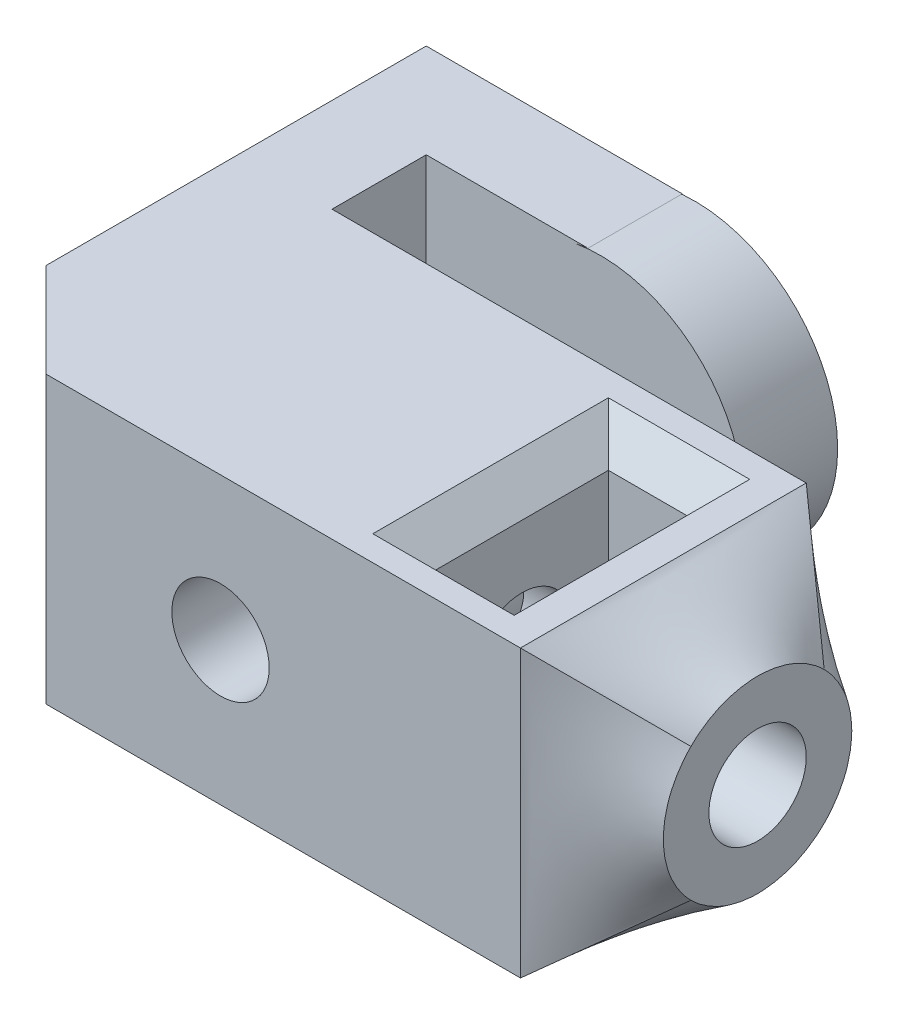
from build123d import *

# Parameters (mm, degrees)
SKETCH1_R               = 4.55
SKETCH1_R_2             = 1.55
BOSS_EXTRUDE1_DEPTH     = 9.1
SKETCH2_R               = 1.55
BOSS_EXTRUDE2_DEPTH     = 3
SKETCH3_W               = 15.1
SKETCH3_H               = 9.1
BOSS_EXTRUDE3_DEPTH     = 3
CUT_EXTRUDE1_REACH      = 26.036
CUT_EXTRUDE1_END_RADIUS = 3.55
SKETCH4_R               = 1.55
SKETCH5_R               = 1.55
CUT_EXTRUDE2_DEPTH      = 2.5
CHAMFER1_SIZE           = 1
CHAMFER2_SIZE           = 3


with BuildPart() as part:
    # Sketch1 → Boss-Extrude1 (new body)
    # profile 1 of 3: a face of its own
    with BuildSketch(Plane.XY):
        with Locations((-94.564189657, 2.5)):
            Circle(SKETCH1_R)
        with Locations((-94.564189657, 2.5)):
            Circle(SKETCH1_R_2, mode=Mode.SUBTRACT)
    # profile 2 of 3: a face of its own
    with BuildSketch(Plane.XY):
        with BuildLine():
            ThreePointArc((-94.564189657, -2.05), (-99.114189657, 2.5), (-94.564189657, 7.05))
            Line((-94.564189657, 7.05), (-100.114189657, 7.05))
            Line((-100.114189657, 7.05), (-100.114189657, -2.05))
            Line((-100.114189657, -2.05), (-94.564189657, -2.05))
        make_face()
    # profile 3 of 3: a face of its own
    with BuildSketch(Plane.XY):
        with BuildLine():
            Line((-85.014189657, 7.05), (-94.564189657, 7.05))
            ThreePointArc((-94.564189657, 7.05), (-91.346853802, 5.717335854), (-90.014189657, 2.5))
            ThreePointArc((-90.014189657, 2.5), (-91.346853802, -0.717335854), (-94.564189657, -2.05))
            Line((-94.564189657, -2.05), (-85.014189657, -2.05))
            Line((-85.014189657, -2.05), (-85.014189657, 7.05))
        make_face()
    extrude(amount=BOSS_EXTRUDE1_DEPTH)



with BuildPart() as body_2:
    # Sketch2 → Boss-Extrude2 (new body)
    # profile 1 of 2: a face of its own
    with BuildSketch(Plane(origin=(0, 0, -3), x_dir=(-1, 0, 0), z_dir=(0, 0, -1))):
        with BuildLine():
            ThreePointArc((95.352918097, 6.981116764), (94.960054991, 7.032746478), (94.564189657, 7.05))
            ThreePointArc((94.564189657, 7.05), (90.014189657, 2.5), (94.564189657, -2.05))
            ThreePointArc((94.564189657, -2.05), (94.960054991, -2.032746478), (95.352918097, -1.981116763))
            ThreePointArc((95.352918097, -1.981116763), (98.049244492, -0.42521671), (99.114189657, 2.5))
            ThreePointArc((99.114189657, 2.5), (98.049244492, 5.42521671), (95.352918097, 6.981116764))
        make_face()
        with Locations(Location((94.564189657, 2.5, 0), (0, 0, 180))):
            Circle(SKETCH2_R, mode=Mode.SUBTRACT)
    # profile 2 of 2: a face of its own
    with BuildSketch(Plane(origin=(0, 0, -3), x_dir=(-1, 0, 0), z_dir=(0, 0, -1))):
        with BuildLine():
            Line((100.114189657, -2.05), (100.114189657, 7.05))
            Line((100.114189657, 7.05), (94.96156182, 7.05))
            Line((94.96156182, 7.05), (95.352918097, 6.981116764))
            ThreePointArc((95.352918097, 6.981116764), (98.049244492, 5.42521671), (99.114189657, 2.5))
            ThreePointArc((99.114189657, 2.5), (98.049244492, -0.42521671), (95.352918097, -1.981116763))
            Line((95.352918097, -1.981116763), (94.96156182, -2.05))
            Line((94.96156182, -2.05), (100.114189657, -2.05))
        make_face()
    extrude(amount=BOSS_EXTRUDE2_DEPTH)


with BuildPart() as part_1:
    add(part.part)

    add(body_2.part)  # Boss-Extrude3 merges body 2
    # Sketch3 → Boss-Extrude3 (add)
    with BuildSketch(Plane.ZY.offset(100.114189657)):
        with Locations((1.55, 2.5)):
            Rectangle(SKETCH3_W, SKETCH3_H)
    extrude(amount=BOSS_EXTRUDE3_DEPTH)

    # Loft1: read off the stored shape, not the designer's step
    # Loft1: loft between two sections, ruled curve by curve
    loft1_from = [
        Edge.make_bspline([(-85.014189657, -2.05, 9.1), (-85.014189657, -2.05, 8.341666667), (-85.014189657, -2.05, 7.583333333), (-85.014189657, -2.05, 6.066666667), (-85.014189657, -2.05, 5.308333333), (-85.014189657, -2.05, 3.791666667), (-85.014189657, -2.05, 3.033333333), (-85.014189657, -2.05, 1.516666667), (-85.014189657, -2.05, 0.758333333), (-85.014189657, -2.05, 0)], [0, 0, 0, 0, 0.25, 0.25, 0.5, 0.5, 0.75, 0.75, 1, 1, 1, 1], 3),
        Edge.make_bspline([(-85.014189657, -2.05, 0), (-85.014189657, -1.291666667, 0), (-85.014189657, -0.533333333, 0), (-85.014189657, 0.983333333, 0), (-85.014189657, 1.741666667, 0), (-85.014189657, 3.258333333, 0), (-85.014189657, 4.016666667, 0), (-85.014189657, 5.533333333, 0), (-85.014189657, 6.291666667, 0), (-85.014189657, 7.05, 0)], [0, 0, 0, 0, 0.25, 0.25, 0.5, 0.5, 0.75, 0.75, 1, 1, 1, 1], 3),
        Edge.make_bspline([(-85.014189657, 7.05, 9.1), (-85.014189657, 6.291666667, 9.1), (-85.014189657, 5.533333333, 9.1), (-85.014189657, 4.016666667, 9.1), (-85.014189657, 3.258333333, 9.1), (-85.014189657, 1.741666667, 9.1), (-85.014189657, 0.983333333, 9.1), (-85.014189657, -0.533333333, 9.1), (-85.014189657, -1.291666667, 9.1), (-85.014189657, -2.05, 9.1)], [0, 0, 0, 0, 0.25, 0.25, 0.5, 0.5, 0.75, 0.75, 1, 1, 1, 1], 3),
        Edge.make_bspline([(-85.014189657, 7.05, 0), (-85.014189657, 7.05, 0.758333333), (-85.014189657, 7.05, 1.516666667), (-85.014189657, 7.05, 3.033333333), (-85.014189657, 7.05, 3.791666667), (-85.014189657, 7.05, 5.308333333), (-85.014189657, 7.05, 6.066666667), (-85.014189657, 7.05, 7.583333333), (-85.014189657, 7.05, 8.341666667), (-85.014189657, 7.05, 9.1)], [0, 0, 0, 0, 0.25, 0.25, 0.5, 0.5, 0.75, 0.75, 1, 1, 1, 1], 3),
    ]
    loft1_to = [
        Edge.make_bspline([(-82.014189657, 0.378679656, 6.671320344), (-82.014189657, 0.128679656, 6.421320344), (-82.014189657, -0.095475789, 6.106038327), (-82.014189657, -0.410975479, 5.377025758), (-82.014189657, -0.5, 4.964213562), (-82.014189657, -0.5, 4.135786438), (-82.014189657, -0.410975479, 3.722974242), (-82.014189657, -0.095475789, 2.993961673), (-82.014189657, 0.128679656, 2.678679656), (-82.014189657, 0.378679656, 2.428679656)], [0, 0, 0, 0, 0.25, 0.25, 0.5, 0.5, 0.75, 0.75, 1, 1, 1, 1], 3),
        Edge.make_bspline([(-82.014189657, 0.378679656, 2.428679656), (-82.014189657, 0.628679656, 2.178679656), (-82.014189657, 0.943961673, 1.954524211), (-82.014189657, 1.672974242, 1.639024521), (-82.014189657, 2.085786438, 1.55), (-82.014189657, 2.914213562, 1.55), (-82.014189657, 3.327025758, 1.639024521), (-82.014189657, 4.056038327, 1.954524211), (-82.014189657, 4.371320344, 2.178679656), (-82.014189657, 4.621320344, 2.428679656)], [0, 0, 0, 0, 0.25, 0.25, 0.5, 0.5, 0.75, 0.75, 1, 1, 1, 1], 3),
        Edge.make_bspline([(-82.014189657, 4.621320344, 6.671320344), (-82.014189657, 4.371320344, 6.921320344), (-82.014189657, 4.056038327, 7.145475789), (-82.014189657, 3.327025758, 7.460975479), (-82.014189657, 2.914213562, 7.55), (-82.014189657, 2.085786438, 7.55), (-82.014189657, 1.672974242, 7.460975479), (-82.014189657, 0.943961673, 7.145475789), (-82.014189657, 0.628679656, 6.921320344), (-82.014189657, 0.378679656, 6.671320344)], [0, 0, 0, 0, 0.25, 0.25, 0.5, 0.5, 0.75, 0.75, 1, 1, 1, 1], 3),
        Edge.make_bspline([(-82.014189657, 4.621320344, 2.428679656), (-82.014189657, 4.871320344, 2.678679656), (-82.014189657, 5.095475789, 2.993961673), (-82.014189657, 5.410975479, 3.722974242), (-82.014189657, 5.5, 4.135786438), (-82.014189657, 5.5, 4.964213562), (-82.014189657, 5.410975479, 5.377025758), (-82.014189657, 5.095475789, 6.106038327), (-82.014189657, 4.871320344, 6.421320344), (-82.014189657, 4.621320344, 6.671320344)], [0, 0, 0, 0, 0.25, 0.25, 0.5, 0.5, 0.75, 0.75, 1, 1, 1, 1], 3),
    ]
    loft1 = Solid(Shell([*[Face.make_surface_from_curves(loft1_from[k], loft1_to[k]) for k in range(4)], Face(Wire(loft1_from)), Face(Wire(loft1_to))]))
    add(loft1)

    # Cut-Extrude1: up to this cylinder (the profile starts outside it)
    cut_extrude1_end = Plane(origin=(-94.564189657, 2.5, 4.55), z_dir=(0, 0, -1)) * Cylinder(CUT_EXTRUDE1_END_RADIUS, 60.172, mode=Mode.PRIVATE)
    # Sketch4 → Cut-Extrude1 (cut, up to the surface)
    with BuildSketch(Plane(origin=(-82.014189657, 0, 0), x_dir=(0, 0, -1), z_dir=(1, 0, 0)), mode=Mode.PRIVATE) as cut_extrude1_sk1:
        with Locations((-4.55, 2.5)):
            Circle(SKETCH4_R)
    cut_extrude1_tool1 = extrude(cut_extrude1_sk1.sketch, amount=-CUT_EXTRUDE1_REACH, mode=Mode.PRIVATE) - cut_extrude1_end
    add(cut_extrude1_tool1.solids().sort_by_distance((-82.01419, 2.5, 4.55))[0], mode=Mode.SUBTRACT)

    # Sketch5 → Cut-Extrude2 (cut)
    # profile 1 of 2: a face of its own
    with BuildSketch(Plane.ZY.offset(87.014189657)):
        Polygon((4.55, 5.675426481), (7.3, 4.08771324), (7.3, 7.05), (1.8, 7.05), (1.8, 4.08771324), align=None)
    # profile 2 of 2: a face of its own
    with BuildSketch(Plane.ZY.offset(87.014189657)):
        Polygon((7.3, 0.91228676), (7.3, 4.08771324), (4.55, 5.675426481), (1.8, 4.08771324), (1.8, 0.91228676), (4.55, -0.675426481), align=None)
        with Locations(Location((4.55, 2.5, 0), (0, 0, 180))):
            Circle(SKETCH5_R, mode=Mode.SUBTRACT)
    extrude(amount=CUT_EXTRUDE2_DEPTH, mode=Mode.SUBTRACT)

    # Chamfer1
    chamfer1_edges = [part_1.edges().sort_by_distance(p)[0] for p in [
        (-87.014189657, 7.05, 4.55),
        (-88.264189657, 7.05, 7.3),
        (-88.264189657, 7.05, 1.8),
        (-89.514189657, 7.05, 4.55),
    ]]
    chamfer(chamfer1_edges, length=CHAMFER1_SIZE)

    # Chamfer2
    chamfer2_edges = [part_1.edges().sort_by_distance(p)[0] for p in [
        (-103.114189657, 2.5, 9.1),
    ]]
    chamfer(chamfer2_edges, length=CHAMFER2_SIZE)


solid = part_1.part
